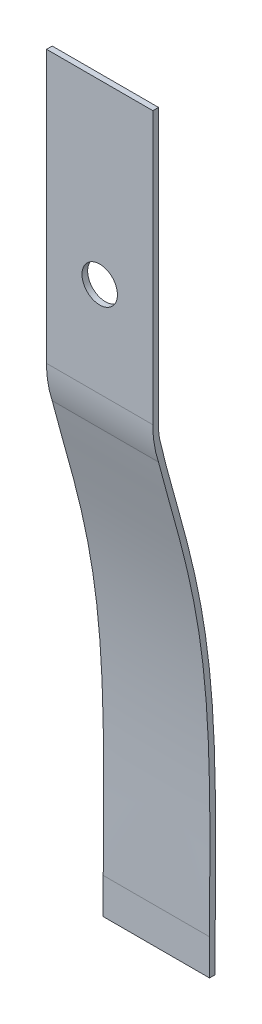
from build123d import *

# Parameters (mm, degrees)
SKETCH1_W           = 19.05
SKETCH1_H           = 139.7
BOSS_EXTRUDE1_DEPTH = 1.016
SKETCH2_R           = 3.175
CUT_EXTRUDE1_DEPTH  = 141.028025341
BOSS_EXTRUDE2_START = -19.05
BOSS_EXTRUDE2_DEPTH = 19.05
CUT_EXTRUDE2_DEPTH  = 142.362614158
FILLET1_R           = 10.16


# Read off the part's stored shape, not the designer's step: Boss-Extrude2
with BuildPart() as part:
    # Sketch1 → Boss-Extrude1 (new body)
    with BuildSketch(Plane.XY):
        with Locations((0, 69.85)):
            Rectangle(SKETCH1_W, SKETCH1_H)
    extrude(amount=BOSS_EXTRUDE1_DEPTH)

    # Sketch2 → Cut-Extrude1 (cut, through all)
    with BuildSketch(Plane.XY.offset(1.016)):
        with Locations((0, 107.95)):
            Circle(SKETCH2_R)
    extrude(amount=-CUT_EXTRUDE1_DEPTH, mode=Mode.SUBTRACT)

    # Boss-Extrude2 outline → Boss-Extrude2 (add)
    with BuildSketch(Plane(origin=(9.525, 0, 0), x_dir=(0, 0, -1), z_dir=(1, 0, 0)).offset(BOSS_EXTRUDE2_START)):
        with BuildLine():
            add(Edge.make_bspline(
                [(-1e-08, 89.021856582), (0.353951992, 87.40678329), (1.153670007, 84.14800116), (2.913866895, 77.737270865), (5.184849484, 69.73490743), (7.461415384, 59.944664253), (9.047721746, 49.78686922), (9.924339704, 39.212202023), (10.183044993, 30.10799928), (10.225102879, 22.747853486), (10.207581307, 17.22630398), (10.179157942, 12.664005658), (10.163337481, 9.05650551), (10.16, 7.285124222), (10.16, 6.395385599)],
                knots=[0.00134616, 0.00134616, 0.00134616, 0.00134616, 0.0625, 0.125, 0.25, 0.375, 0.5, 0.625, 0.75, 0.8125, 0.875, 0.9375, 0.96875, 1, 1, 1, 1], degree=3))
            Line((-1e-08, 89.021856582), (0, 84.644701296))
            add(Edge.make_bspline(
                [(0, 84.644701296), (3.804384443, 69.740616889), (9.143429465, 56.08795928), (9.602178505, 40.318745924), (9.144, 22.473473321), (9.144, 6.395385599)],
                knots=[0.053605471, 0.053605471, 0.053605471, 0.053605471, 0.053605471, 0.053605471, 1, 1, 1, 1, 1, 1], degree=5))
            Line((9.144, 6.395385599), (9.144, 0))
            Line((9.144, 0), (10.16, 0))
            Line((10.16, 0), (10.16, 6.395385599))
        make_face()
    extrude(amount=BOSS_EXTRUDE2_DEPTH)

    # Sketch4 → Cut-Extrude2 (cut, through all)
    with BuildSketch(Plane(origin=(9.525, 0, 0), x_dir=(0, 0, -1), z_dir=(1, 0, 0))):
        with BuildLine():
            Line((-1.016, 90.953756608), (-1.016, 0))
            Line((-1.016, 0), (0, 0))
            Line((0, 0), (0, 84.644701296))
            add(Edge.make_bspline(
                [(0, 84.644701296), (-1.016, 87.704234075), (-1.016, 90.953756608)],
                knots=[0, 0, 0, 1, 1, 1], degree=2))
        make_face()
    extrude(amount=-CUT_EXTRUDE2_DEPTH, mode=Mode.SUBTRACT)

    # Fillet1
    fillet1_edges = [part.edges().sort_by_distance(p)[0] for p in [
        (0, 89.021856582, 1e-08),
    ]]
    fillet(fillet1_edges, radius=FILLET1_R)


solid = part.part
